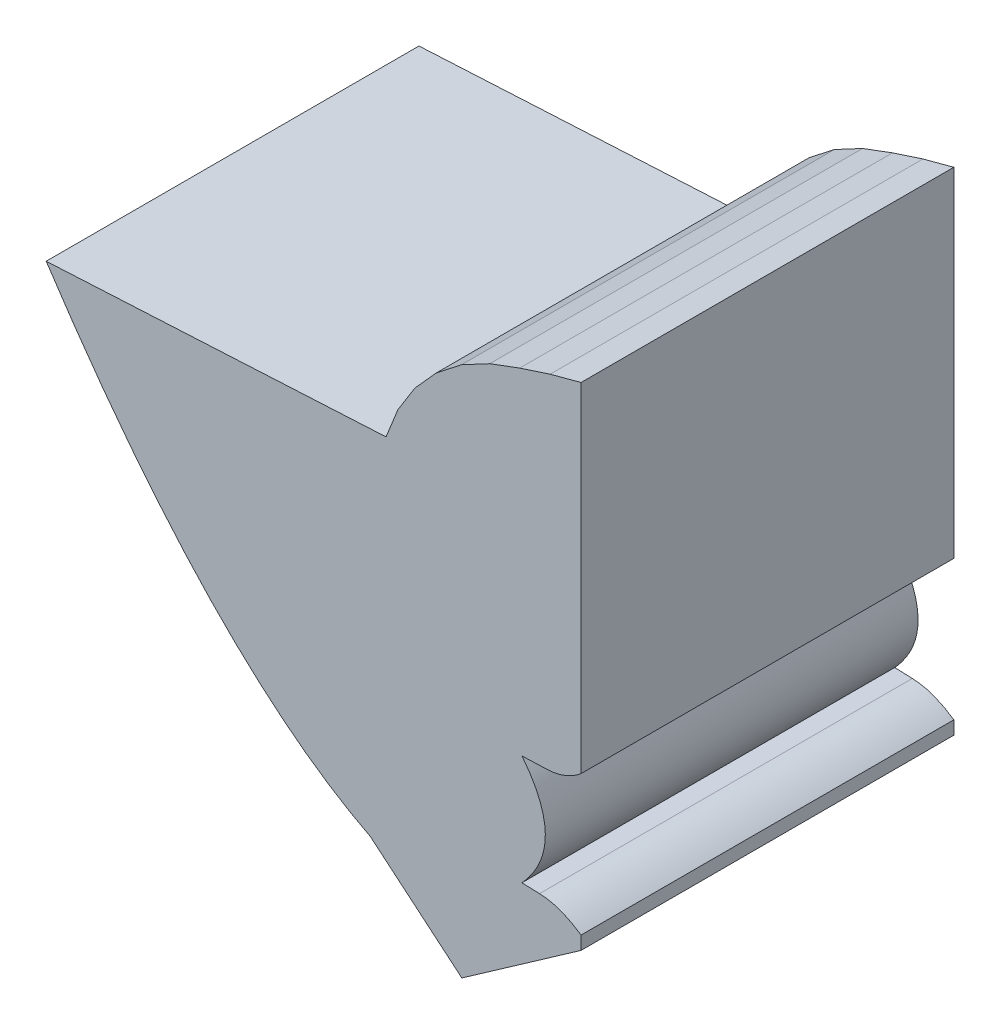
from build123d import *

# Parameters (mm, degrees)
CROQUIS_BASE_DEPTH              = 6.9937
LENTE_PPAL_1_REACH              = 29.176
LENTE_PPAL_1_DIRECTION_2_REACH  = 29.176
LENTE_PPAL_2_DEPTH              = 28.175928622
LENTE_PPAL_2_DEPTH_BACK         = 28.175928622
CROQUIS9_3_OUTSIDE_W            = 30.065
CROQUIS9_3_OUTSIDE_H            = 25.937
LENTE_FRONTAL_REACH             = 25.403
LENTE_FRONTAL_DIRECTION_2_REACH = 25.403
LENTE_TRASERA_REACH             = 28.281
LENTE_TRASERA_DIRECTION_2_REACH = 28.281


with BuildPart() as part:
    # Croquis1 → croquis base (new, symmetric)
    with BuildSketch(Plane.XY):
        with BuildLine():
            Line((-6.994875026, 10.477389992), (-8.981845695, 12.608155172))
            Line((-8.981845695, 12.608155172), (-23.035921146, 11.871612288))
            Line((-23.035921146, 11.871612288), (-23.035921146, 11.54013782))
            ThreePointArc((-23.035921146, 11.54013782), (-20.949684518, 9.582335705), (-18.945192114, 7.540918896))
            add(Edge.make_bspline(
                [(-18.945192114, 7.540918896), (-10.215008384, -3.697644103), (-2.846604825, -5.059081104)],
                knots=[0.497667241, 0.497667241, 0.497667241, 0.49955428, 0.49955428, 0.49955428], degree=2))
            add(Edge.make_bspline(
                [(-2.846604825, -5.059081104), (-2.498165198, -4.87297933), (-2.177330417, -4.684462446)],
                knots=[0.498812075, 0.498812075, 0.498812075, 0.498911556, 0.498911556, 0.498911556], degree=2))
            Line((-2.177330418, -4.684462446), (-2.177330418, 6.186438919))
            add(Edge.make_bspline(
                [(-2.177330418, 6.186438919), (-4.063319702, 8.141636997), (-6.994875026, 10.477389992)],
                knots=[0.50138293, 0.50138293, 0.50138293, 0.502013312, 0.502013312, 0.502013312], degree=2))
        make_face()
    extrude(amount=CROQUIS_BASE_DEPTH, both=True)

    # lente ppal 1: up to this face of the body (flat: up to its plane)
    lente_ppal_1_end = Plane(part.part.faces().sort_by_distance((-10.153546236, 5.159655324, 6.9937))[0])
    # Croquis9 → lente ppal 1 (add, up to the picked face)
    with BuildSketch(Plane.XY, mode=Mode.PRIVATE) as lente_ppal_1_sk1:
        with BuildLine():
            Line((-2.177330418, -4.388282022), (-2.177330418, -1.840420572))
            add(Edge.make_bspline(
                [(-2.177330418, 2.424232079), (-0.304369248, 0.128042884), (-2.177330418, -1.840420572)],
                knots=[0, 0, 0, 1, 1, 1], degree=2))
            Line((-2.177330418, 2.424232079), (-2.177330418, 6.082860828))
            Line((-2.177330418, 6.082860828), (-10.309820395, 10))
            Line((-10.309820395, 10), (-19.969359014, 9.493765032))
            add(Edge.make_bspline(
                [(-2.177330418, -4.388282022), (-10.4130765, -4.994158739), (-19.969359014, 9.493765032)],
                knots=[0, 0, 0, 1, 1, 1], degree=2))
        make_face()
    lente_ppal_1_tool1 = split(extrude(lente_ppal_1_sk1.sketch, amount=LENTE_PPAL_1_REACH, mode=Mode.PRIVATE), bisect_by=lente_ppal_1_end, keep=Keep.BOTH, mode=Mode.PRIVATE)
    add(lente_ppal_1_tool1.solids().sort_by(Axis((-9.106368, 3.599172, 0), (0, 0, 1)))[0])

    # lente ppal 1 direction 2: up to this face of the body (flat: up to its plane)
    lente_ppal_1_direction_2_end = Plane(part.part.faces().sort_by_distance((-10.153546236, 5.159655324, -6.9937))[0])
    # Croquis9 → lente ppal 1 direction 2 (add, up to the picked face)
    with BuildSketch(Plane.XY, mode=Mode.PRIVATE) as lente_ppal_1_direction_2_sk1:
        with BuildLine():
            Line((-2.177330418, -4.388282022), (-2.177330418, -1.840420572))
            add(Edge.make_bspline(
                [(-2.177330418, 2.424232079), (-0.304369248, 0.128042884), (-2.177330418, -1.840420572)],
                knots=[0, 0, 0, 1, 1, 1], degree=2))
            Line((-2.177330418, 2.424232079), (-2.177330418, 6.082860828))
            Line((-2.177330418, 6.082860828), (-10.309820395, 10))
            Line((-10.309820395, 10), (-19.969359014, 9.493765032))
            add(Edge.make_bspline(
                [(-2.177330418, -4.388282022), (-10.4130765, -4.994158739), (-19.969359014, 9.493765032)],
                knots=[0, 0, 0, 1, 1, 1], degree=2))
        make_face()
    lente_ppal_1_direction_2_tool1 = split(extrude(lente_ppal_1_direction_2_sk1.sketch, amount=-LENTE_PPAL_1_DIRECTION_2_REACH, mode=Mode.PRIVATE), bisect_by=lente_ppal_1_direction_2_end, keep=Keep.BOTH, mode=Mode.PRIVATE)
    add(lente_ppal_1_direction_2_tool1.solids().sort_by(Axis((-9.106368, 3.599172, 0), (0, 0, -1)))[0])

    # Croquis9<3> outside → lente ppal 2 (cut, two sides: drawn at the far end of the back side and taken through both)
    with BuildSketch(Plane.XY.offset(-LENTE_PPAL_2_DEPTH_BACK)):
        with Locations((-12.1385, 3.7745)):
            Rectangle(CROQUIS9_3_OUTSIDE_W, CROQUIS9_3_OUTSIDE_H)
        with BuildLine():
            Line((-2.177330418, -1.840420572), (-2.177330418, -4.388282022))
            add(Edge.make_bspline(
                [(-2.177330418, -4.388282022), (-10.4130765, -4.994158739), (-19.969359014, 9.493765032)],
                knots=[0, 0, 0, 1, 1, 1], degree=2))
            Line((-19.969359014, 9.493765032), (-10.309820395, 10))
            Line((-10.309820395, 10), (-2.177330418, 6.082860828))
            Line((-2.177330418, 6.082860828), (-2.177330418, 2.424232079))
            add(Edge.make_bspline(
                [(-2.177330418, 2.424232079), (-0.304369248, 0.128042884), (-2.177330418, -1.840420572)],
                knots=[0, 0, 0, 1, 1, 1], degree=2))
        make_face(mode=Mode.SUBTRACT)
    extrude(amount=LENTE_PPAL_2_DEPTH + LENTE_PPAL_2_DEPTH_BACK, mode=Mode.SUBTRACT)

    # lente frontal: up to this face of the body (flat: up to its plane)
    lente_frontal_end = Plane(part.part.faces().sort_by_distance((-9.106367081, 3.599171888, 6.9937))[0])
    # Croquis8 → lente frontal (add, up to the picked face)
    with BuildSketch(Plane.XY, mode=Mode.PRIVATE) as lente_frontal_sk1:
        with BuildLine():
            Line((0.1, 2.877673418), (0.1, 15.587903347))
            Line((0.1, 15.587903347), (-1.059110992, 15.277320493))
            Line((-1.059110992, 15.277320493), (-2.200378811, 14.9065001))
            Line((-2.200378811, 14.9065001), (-3.324385438, 14.486251242))
            Line((-3.324385438, 14.486251242), (-4.38392255, 13.922885367))
            Line((-4.38392255, 13.922885367), (-5.329535454, 13.184091597))
            Line((-5.329535454, 13.184091597), (-6.132492182, 12.292317806))
            Line((-6.132492182, 12.292317806), (-6.768395299, 11.274660091))
            Line((-6.768395299, 11.274660091), (-7.217923211, 10.162039465))
            Line((-7.217923211, 10.162039465), (-10.309820395, 10))
            Line((-10.309820395, 10), (-2.177330418, 2.342487007))
            Line((-2.177330418, 2.342487007), (-1.190501641, 2.376947827))
            add(Edge.make_bspline(
                [(-1.190501641, 2.376947827), (-0.463368169, 2.402339888), (0.1, 2.877673418)],
                knots=[0, 0, 0, 1, 1, 1], degree=2))
        make_face()
    lente_frontal_tool1 = split(extrude(lente_frontal_sk1.sketch, amount=LENTE_FRONTAL_REACH, mode=Mode.PRIVATE), bisect_by=lente_frontal_end, keep=Keep.BOTH, mode=Mode.PRIVATE)
    add(lente_frontal_tool1.solids().sort_by(Axis((-3.290182, 8.96302, 0), (0, 0, 1)))[0])

    # lente frontal direction 2: up to this face of the body (flat: up to its plane)
    lente_frontal_direction_2_end = Plane(part.part.faces().sort_by_distance((-9.106367081, 3.599171888, -6.9937))[0])
    # Croquis8 → lente frontal direction 2 (add, up to the picked face)
    with BuildSketch(Plane.XY, mode=Mode.PRIVATE) as lente_frontal_direction_2_sk1:
        with BuildLine():
            Line((0.1, 2.877673418), (0.1, 15.587903347))
            Line((0.1, 15.587903347), (-1.059110992, 15.277320493))
            Line((-1.059110992, 15.277320493), (-2.200378811, 14.9065001))
            Line((-2.200378811, 14.9065001), (-3.324385438, 14.486251242))
            Line((-3.324385438, 14.486251242), (-4.38392255, 13.922885367))
            Line((-4.38392255, 13.922885367), (-5.329535454, 13.184091597))
            Line((-5.329535454, 13.184091597), (-6.132492182, 12.292317806))
            Line((-6.132492182, 12.292317806), (-6.768395299, 11.274660091))
            Line((-6.768395299, 11.274660091), (-7.217923211, 10.162039465))
            Line((-7.217923211, 10.162039465), (-10.309820395, 10))
            Line((-10.309820395, 10), (-2.177330418, 2.342487007))
            Line((-2.177330418, 2.342487007), (-1.190501641, 2.376947827))
            add(Edge.make_bspline(
                [(-1.190501641, 2.376947827), (-0.463368169, 2.402339888), (0.1, 2.877673418)],
                knots=[0, 0, 0, 1, 1, 1], degree=2))
        make_face()
    lente_frontal_direction_2_tool1 = split(extrude(lente_frontal_direction_2_sk1.sketch, amount=-LENTE_FRONTAL_DIRECTION_2_REACH, mode=Mode.PRIVATE), bisect_by=lente_frontal_direction_2_end, keep=Keep.BOTH, mode=Mode.PRIVATE)
    add(lente_frontal_direction_2_tool1.solids().sort_by(Axis((-3.290182, 8.96302, 0), (0, 0, -1)))[0])

    # lente trasera: up to this face of the body (flat: up to its plane)
    lente_trasera_end = Plane(part.part.faces().sort_by_distance((-7.357064552, 5.305385386, 6.9937))[0])
    # Croquis11 → lente trasera (add, up to the picked face)
    with BuildSketch(Plane.XY, mode=Mode.PRIVATE) as lente_trasera_sk1:
        with BuildLine():
            Line((0.1, -2.367807069), (0.1, -2.867807069))
            Line((0.1, -2.867807069), (-4.373235091, -6))
            Line((-4.373235091, -6), (-9.72117641, -1.512544411))
            Line((-9.72117641, -1.512544411), (-1.458120605, -1.801096678))
            add(Edge.make_bspline(
                [(-1.458120605, -1.801096678), (-0.674591915, -1.828458103), (0.1, -2.367807069)],
                knots=[0, 0, 0, 1, 1, 1], degree=2))
        make_face()
    lente_trasera_tool1 = split(extrude(lente_trasera_sk1.sketch, amount=LENTE_TRASERA_REACH, mode=Mode.PRIVATE), bisect_by=lente_trasera_end, keep=Keep.BOTH, mode=Mode.PRIVATE)
    add(lente_trasera_tool1.solids().sort_by(Axis((-4.3944, -3.179865, 0), (0, 0, 1)))[0])

    # lente trasera direction 2: up to this face of the body (flat: up to its plane)
    lente_trasera_direction_2_end = Plane(part.part.faces().sort_by_distance((-7.357064552, 5.305385386, -6.9937))[0])
    # Croquis11 → lente trasera direction 2 (add, up to the picked face)
    with BuildSketch(Plane.XY, mode=Mode.PRIVATE) as lente_trasera_direction_2_sk1:
        with BuildLine():
            Line((0.1, -2.367807069), (0.1, -2.867807069))
            Line((0.1, -2.867807069), (-4.373235091, -6))
            Line((-4.373235091, -6), (-9.72117641, -1.512544411))
            Line((-9.72117641, -1.512544411), (-1.458120605, -1.801096678))
            add(Edge.make_bspline(
                [(-1.458120605, -1.801096678), (-0.674591915, -1.828458103), (0.1, -2.367807069)],
                knots=[0, 0, 0, 1, 1, 1], degree=2))
        make_face()
    lente_trasera_direction_2_tool1 = split(extrude(lente_trasera_direction_2_sk1.sketch, amount=-LENTE_TRASERA_DIRECTION_2_REACH, mode=Mode.PRIVATE), bisect_by=lente_trasera_direction_2_end, keep=Keep.BOTH, mode=Mode.PRIVATE)
    add(lente_trasera_direction_2_tool1.solids().sort_by(Axis((-4.3944, -3.179865, 0), (0, 0, -1)))[0])


solid = part.part
